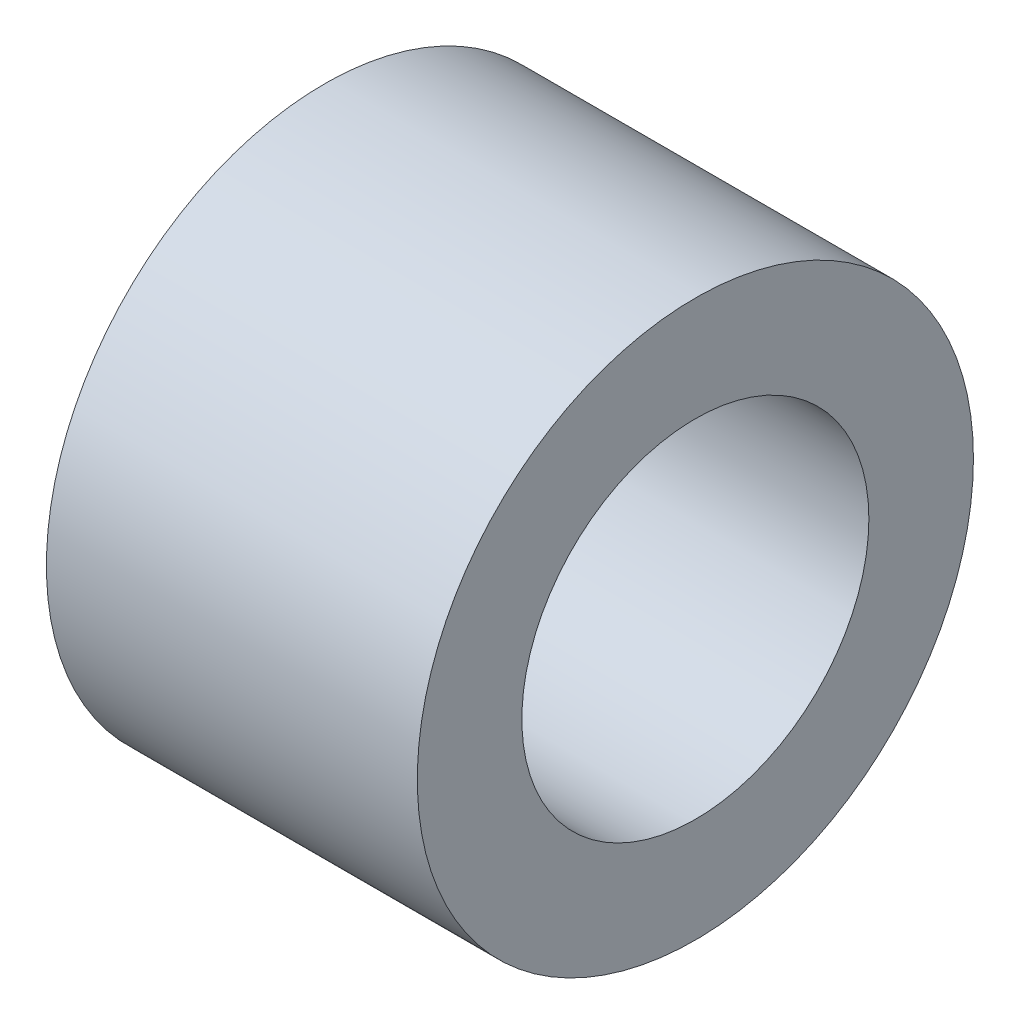
from build123d import *

# Parameters (mm, degrees)
SKETCH1_R           = 7.9375
SKETCH1_R_2         = 4.953
BOSS_EXTRUDE1_DEPTH = 10.587500066


with BuildPart() as part:
    # Sketch1 → Boss-Extrude1 (new body)
    with BuildSketch(Plane(origin=(0, 0, 0), x_dir=(0, 0, -1), z_dir=(1, 0, 0))):
        Circle(SKETCH1_R)
        Circle(SKETCH1_R_2, mode=Mode.SUBTRACT)
    extrude(amount=BOSS_EXTRUDE1_DEPTH)


solid = part.part
